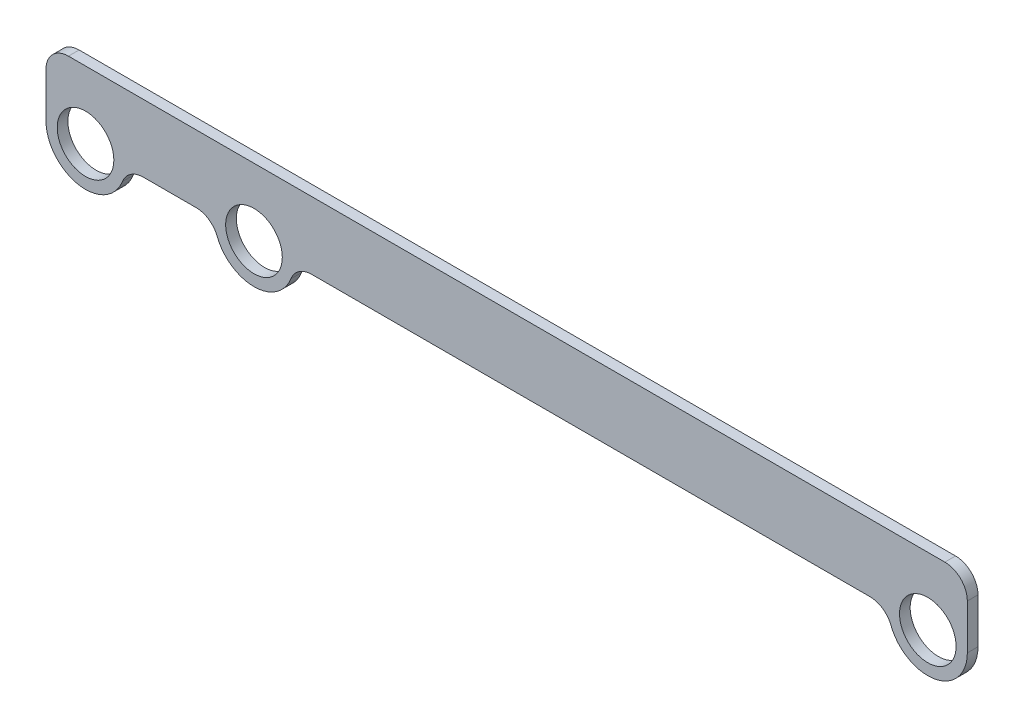
from build123d import *

# Parameters (mm, degrees)
ESBO_O2_R          = 25.2
FLANGE_BASE1_DEPTH = 9.5
FILETE1_R          = 20


# Sheet-metal steps are written as plain solids
with BuildPart() as part:
    # Esboço2 → Flange-base1 (new body)
    with BuildSketch(Plane.XY):
        with BuildLine():
            Line((410.336115278, -12.808345835), (410.336115278, 47.191654165))
            Line((410.336115278, 47.191654165), (-410.063884722, 47.191654165))
            Line((-410.063884722, 47.191654165), (-410.063884722, -12.808345835))
            ThreePointArc((-410.063884722, -12.808345835), (-374.863884722, -48.008345835), (-339.663884722, -12.808345835))
            Line((-339.663884722, -12.808345835), (-260.063884722, -12.808345835))
            ThreePointArc((-260.063884722, -12.808345835), (-224.863884722, -48.008345835), (-189.663884722, -12.808345835))
            Line((-189.663884722, -12.808345835), (339.936115278, -12.808345835))
            ThreePointArc((339.936115278, -12.808345835), (375.136115278, -48.008345835), (410.336115278, -12.808345835))
        make_face()
        with Locations((375.136115278, -12.808345835)):
            Circle(ESBO_O2_R, mode=Mode.SUBTRACT)
        with Locations((-224.863884722, -12.808345835)):
            Circle(ESBO_O2_R, mode=Mode.SUBTRACT)
        with Locations((-374.863884722, -12.808345835)):
            Circle(ESBO_O2_R, mode=Mode.SUBTRACT)
    extrude(amount=-FLANGE_BASE1_DEPTH)

    # Filete1
    filete1_edges = [part.edges().sort_by_distance(p)[0] for p in [
        (339.936115278, -12.808345835, -4.75),
        (-189.663884722, -12.808345835, -4.75),
        (-260.063884722, -12.808345835, -4.75),
        (-339.663884722, -12.808345835, -4.75),
        (-410.063884722, 47.191654165, -4.75),
        (410.336115278, 47.191654165, -4.75),
    ]]
    fillet(filete1_edges, radius=FILETE1_R)


solid = part.part
